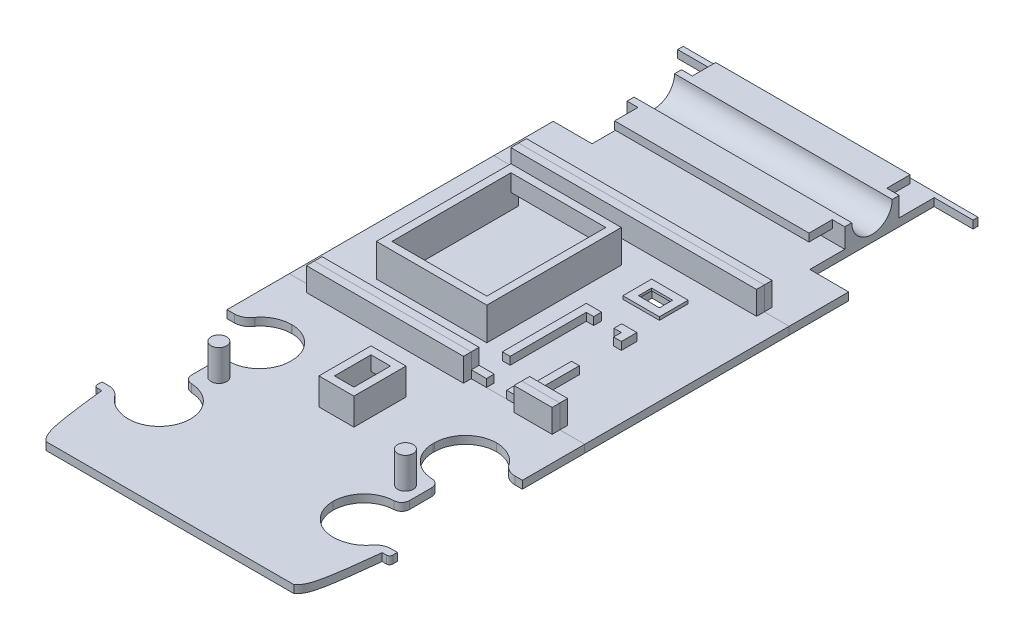
from build123d import *

# Parameters (mm, degrees)
CROQUIS1_W               = 140
CROQUIS1_H               = 490
SALIENTE_EXTRUIR1_DEPTH  = 5
CROQUIS2_R               = 5
SALIENTE_EXTRUIR2_DEPTH  = 20
SALIENTE_EXTRUIR3_DEPTH  = 140
CROQUIS4_W               = 55
CROQUIS4_H               = 5
CROQUIS4_W_2             = 205
CROQUIS4_W_3             = 60
SALIENTE_EXTRUIR4_DEPTH  = 25
CROQUIS5_W               = 60
CROQUIS5_H               = 5
CROQUIS5_W_2             = 205
CROQUIS5_W_3             = 55
SALIENTE_EXTRUIR5_DEPTH  = 25
CROQUIS6_W               = 35.863761151
CROQUIS6_H               = 39.757540934
CROQUIS6_H_2             = 40.782219824
CORTAR_EXTRUIR1_DEPTH    = 264.533679062
REDONDEO1_R              = 5
CORTAR_EXTRUIR2_REACH    = 265.534
CORTAR_EXTRUIR3_REACH    = 265.534
CROQUIS9_W               = 22.5
CROQUIS9_H               = 33.5
CROQUIS9_W_2             = 12.5
CROQUIS9_H_2             = 23.5
SALIENTE_EXTRUIR6_DEPTH  = 17.3
CORTAR_EXTRUIR4_REACH    = 302.975
CROQUIS11_W              = 12.5
CROQUIS11_H              = 8
CROQUIS12_W              = 81
CROQUIS12_H              = 96.5
CROQUIS12_W_2            = 61
CROQUIS12_H_2            = 76.5
SALIENTE_EXTRUIR7_DEPTH  = 21
CORTAR_EXTRUIR5_REACH    = 269.763
CROQUIS13_W              = 61
CROQUIS13_H              = 10
REDONDEO2_R              = 20
REDONDEO3_R              = 20
REDONDEO4_R              = 20
CROQUIS14_W              = 13.297924196
CROQUIS14_H              = 5
SALIENTE_EXTRUIR8_DEPTH  = 4.816753
REDONDEO5_R              = 10
CROQUIS15_W              = 13.297924196
CROQUIS15_H              = 5
SALIENTE_EXTRUIR9_DEPTH  = 4.816753
REDONDEO6_R              = 10
SALIENTE_EXTRUIR10_DEPTH = 5
CROQUIS17_R              = 13
CORTAR_EXTRUIR6_DEPTH    = 290.478958921
CROQUIS18_W              = 125
CROQUIS18_H              = 5
SALIENTE_EXTRUIR11_DEPTH = 15
CROQUIS19_W              = 125
CROQUIS19_H              = 5
SALIENTE_EXTRUIR12_DEPTH = 15
SALIENTE_EXTRUIR13_DEPTH = 5
CORTAR_EXTRUIR7_START    = -21
CROQUIS21_W              = 81
CROQUIS21_H              = 96.5
CROQUIS21_W_2            = 71
CROQUIS21_H_2            = 86.5
CORTAR_EXTRUIR7_DEPTH    = 21
CROQUIS22_W              = 23.5
CROQUIS22_H              = 18.5
CROQUIS22_W_2            = 13.5
CROQUIS22_H_2            = 8.5
SALIENTE_EXTRUIR14_DEPTH = 2
CROQUIS23_W              = 13.5
CROQUIS23_H              = 8.5
CORTAR_EXTRUIR8_DEPTH    = 256.662018384
CROQUIS24_W              = 16
CROQUIS24_H              = 11.5
CORTAR_EXTRUIR9_DEPTH    = 5.5
CROQUIS25_W              = 158
CROQUIS25_H              = 10
CROQUIS25_W_2            = 101.022508216
CROQUIS25_W_3            = 24.477491784
SALIENTE_EXTRUIR15_DEPTH = 15


# Read off the part's stored shape, not the designer's step: Partir2
with BuildPart() as part:
    # Croquis1 → Saliente-Extruir1 (new body)
    with BuildSketch(Plane(origin=(0, 0, 0), x_dir=(1, 0, 0), z_dir=(0, 1, 0))):
        Rectangle(CROQUIS1_W, CROQUIS1_H)
    extrude(amount=SALIENTE_EXTRUIR1_DEPTH)

    # Croquis2 → Saliente-Extruir2 (add)
    with BuildSketch(Plane(origin=(0, 5, 0), x_dir=(1, 0, 0), z_dir=(0, 1, 0))):
        with Locations(Location((60, -145, 0), (0, 0, 270))):
            Circle(CROQUIS2_R)
        with Locations(Location((-60, -145, 0), (0, 0, 90))):
            Circle(CROQUIS2_R)
    extrude(amount=SALIENTE_EXTRUIR2_DEPTH)

    # Croquis3 → Saliente-Extruir3 (add, through all)
    with BuildSketch(Plane(origin=(70, 0, 0), x_dir=(0, 0, -1), z_dir=(1, 0, 0))):
        with BuildLine():
            Line((158, 17.5), (162.5, 17.5))
            Line((162.5, 17.5), (162.5, 5.107393915))
            Line((162.5, 5.107393915), (159.549400497, 3.568901756))
            Line((159.549400497, 3.568901756), (127.5, 4.093822174))
            Line((127.5, 4.093822174), (127.5, 6.056909612))
            Line((127.5, 6.056909612), (127.5, 17.5))
            Line((127.5, 17.5), (132, 17.5))
            ThreePointArc((132, 17.5), (145, 4.5), (158, 17.5))
        make_face()
    extrude(amount=-SALIENTE_EXTRUIR3_DEPTH)

    # Croquis4 → Saliente-Extruir4 (add)
    with BuildSketch(Plane(origin=(70, 0, 0), x_dir=(0, 0, -1), z_dir=(1, 0, 0))):
        with Locations((-217.5, 2.5)):
            Rectangle(CROQUIS4_W, CROQUIS4_H)
        with Locations((2.5, 2.5)):
            Rectangle(CROQUIS4_W_2, CROQUIS4_H)
        with Locations((215, 2.5)):
            Rectangle(CROQUIS4_W_3, CROQUIS4_H)
    extrude(amount=SALIENTE_EXTRUIR4_DEPTH)

    # Croquis5 → Saliente-Extruir5 (add)
    with BuildSketch(Plane.ZY.offset(70)):
        with Locations((-215, 2.5)):
            Rectangle(CROQUIS5_W, CROQUIS5_H)
        with Locations((-2.5, 2.5)):
            Rectangle(CROQUIS5_W_2, CROQUIS5_H)
        with Locations((217.5, 2.5)):
            Rectangle(CROQUIS5_W_3, CROQUIS5_H)
    extrude(amount=SALIENTE_EXTRUIR5_DEPTH)

    # Croquis6 → Cortar-Extruir1 (cut, through all)
    with BuildSketch(Plane(origin=(0, 5, 0), x_dir=(1, 0, 0), z_dir=(0, 1, 0))):
        with Locations((63.770195229, -177.328194943)):
            Rectangle(CROQUIS6_W, CROQUIS6_H)
        with Locations((-63.770195229, -177.328194943)):
            Rectangle(CROQUIS6_W, CROQUIS6_H)
        with Locations((-63.770195229, -112.670956981)):
            Rectangle(CROQUIS6_W, CROQUIS6_H_2)
        with Locations((63.770195229, -112.670956981)):
            Rectangle(CROQUIS6_W, CROQUIS6_H_2)
    extrude(amount=-CORTAR_EXTRUIR1_DEPTH, mode=Mode.SUBTRACT)

    # Redondeo1
    redondeo1_edges = [part.edges().sort_by_distance(p)[0] for p in [
        (70, 2.5, 157.449424476),
        (-70, 2.5, 133.062066893),
        (-70, 2.5, 157.449424476),
        (70, 2.5, 133.062066893),
    ]]
    fillet(redondeo1_edges, radius=REDONDEO1_R)

    # Croquis7 → Cortar-Extruir2 (cut, up to next)
    with BuildSketch(Plane(origin=(0, 5, 0), x_dir=(1, 0, 0), z_dir=(0, 1, 0)), mode=Mode.PRIVATE) as cortar_extruir2_sk1:
        Polygon((-95, 188.571267431), (95, 188.183246837), (95, 245), (-95, 245), align=None)
    cortar_extruir2_tool1 = extrude(cortar_extruir2_sk1.sketch, amount=-CORTAR_EXTRUIR2_REACH, mode=Mode.PRIVATE) & part.part
    add(cortar_extruir2_tool1.solids().sort_by_distance((0.108502, 5, -216.688518))[0], mode=Mode.SUBTRACT)

    # Croquis8 → Cortar-Extruir3 (cut, up to next)
    with BuildSketch(Plane(origin=(0, 5, 0), x_dir=(1, 0, 0), z_dir=(0, 1, 0)), mode=Mode.PRIVATE) as cortar_extruir3_sk1:
        Polygon((-95, -190), (-45.838314653, -190), (-45.838314653, -197.20696541), (45.838314653, -197.20696541), (45.838314653, -190), (95, -190), (95, -245), (-95, -245), align=None)
    cortar_extruir3_tool1 = extrude(cortar_extruir3_sk1.sketch, amount=-CORTAR_EXTRUIR3_REACH, mode=Mode.PRIVATE) & part.part
    add(cortar_extruir3_tool1.solids().sort_by_distance((0, 5, 219.112852))[0], mode=Mode.SUBTRACT)

    # Croquis9 → Saliente-Extruir6 (add)
    with BuildSketch(Plane(origin=(0, 5, 0), x_dir=(1, 0, 0), z_dir=(0, 1, 0))):
        with Locations((0, -112.670956981)):
            Rectangle(CROQUIS9_W, CROQUIS9_H)
        with Locations((0, -112.670956981)):
            Rectangle(CROQUIS9_W_2, CROQUIS9_H_2, mode=Mode.SUBTRACT)
    extrude(amount=SALIENTE_EXTRUIR6_DEPTH)

    # Croquis11 → Cortar-Extruir4 (cut, up to next)
    with BuildSketch(Plane(origin=(0, 0, 95.920956981), x_dir=(-1, 0, 0), z_dir=(0, 0, -1)), mode=Mode.PRIVATE) as cortar_extruir4_sk1:
        with Locations((0, 9)):
            Rectangle(CROQUIS11_W, CROQUIS11_H)
    cortar_extruir4_tool1 = extrude(cortar_extruir4_sk1.sketch, amount=-CORTAR_EXTRUIR4_REACH, mode=Mode.PRIVATE) & part.part
    add(cortar_extruir4_tool1.solids().sort_by_distance((0, 9, 95.920957))[0], mode=Mode.SUBTRACT)

    # Croquis12 → Saliente-Extruir7 (add)
    with BuildSketch(Plane(origin=(0, 5, 0), x_dir=(1, 0, 0), z_dir=(0, 1, 0))):
        with Locations((-28.477491784, 3.533159356)):
            Rectangle(CROQUIS12_W, CROQUIS12_H)
        with Locations((-28.477491784, 3.533159356)):
            Rectangle(CROQUIS12_W_2, CROQUIS12_H_2, mode=Mode.SUBTRACT)
    extrude(amount=SALIENTE_EXTRUIR7_DEPTH)

    # Croquis13 → Cortar-Extruir5 (cut, up to next)
    with BuildSketch(Plane(origin=(0, 0, -51.783159356), x_dir=(-1, 0, 0), z_dir=(0, 0, -1)), mode=Mode.PRIVATE) as cortar_extruir5_sk1:
        with Locations((28.477491784, 10)):
            Rectangle(CROQUIS13_W, CROQUIS13_H)
    cortar_extruir5_tool1 = extrude(cortar_extruir5_sk1.sketch, amount=-CORTAR_EXTRUIR5_REACH, mode=Mode.PRIVATE) & part.part
    add(cortar_extruir5_tool1.solids().sort_by_distance((-28.477492, 10, -51.783159))[0], mode=Mode.SUBTRACT)

    # Redondeo2
    # the kernel refuses this fillet: 20 mm, written as the material it adds along each edge
    with BuildSketch(Plane(origin=(81.702075804, 5, 92.279847069), x_dir=(-1, 0, 0), z_dir=(0, -1, 0))) as redondeo2_piece_1:
        with BuildLine():
            CenterArc((15.786239449, -20), REDONDEO2_R, 90, 52.121260667)
            Line((0, -7.720152931), (-0.315724789, -7.474555989))
            ThreePointArc((-0.315724789, -7.474555989), (-0.4, -3.860076465), (-0.4, 0))
            Line((-0.4, 0), (0, 0.4))
            Line((0, 0.4), (15.786239449, 0.4))
            Line((15.786239449, 0.4), (15.786239449, 0))
        make_face()
    extrude(amount=5)

    # Redondeo3
    redondeo3_edges = [part.edges().sort_by_distance(p)[0] for p in [
        (45.838314653, 2.5, 157.449424476),
        (45.838314653, 2.5, 92.279847069),
        (45.838314653, 2.5, 133.062066893),
    ]]
    fillet(redondeo3_edges, radius=REDONDEO3_R)

    # Redondeo4
    # the kernel refuses this fillet: 20 mm, written as the material it adds along each edge
    with BuildSketch(Plane(origin=(-45.838314653, 5, 157.449424476), x_dir=(0, 0, 1), z_dir=(0, -1, 0))) as redondeo4_piece_1:
        with BuildLine():
            CenterArc((19.985940618, 20), REDONDEO4_R, 181.921635901, 88.078364099)
            Line((-0.002811876, 19.329348278), (-2.001687126, 19.262283105))
            ThreePointArc((-2.001687126, 19.262283105), (-2, 19.161685347), (-2, 0))
            Line((-2, 0), (0, -2))
            Line((0, -2), (19.985940618, -2))
            Line((19.985940618, -2), (19.985940618, 0))
        make_face()
    extrude(amount=5)
    with BuildSketch(Plane(origin=(-45.838314653, 5, 133.062066893), x_dir=(-0.9999999894189673, 0, 0.0001454718712798051), z_dir=(0, -1, 0))) as redondeo4_piece_2:
        with BuildLine():
            CenterArc((19.997092396, 19.988849843), REDONDEO4_R, 180.008334924, 88.078364099)
            Line((-0.002907392, 19.985940406), (-2.002907371, 19.985649462))
            Line((-2.002907371, 19.985649462), (-1.999999979, -0.000290944))
            Line((-1.999999979, -0.000290944), (0.000290944, -1.999999979))
            ThreePointArc((0.000290944, -1.999999979), (19.161976088, -1.997212493), (19.262574091, -1.998884984))
            Line((19.262574091, -1.998884984), (19.329348482, 0))
        make_face()
    extrude(amount=5)
    with BuildSketch(Plane(origin=(-81.702075804, 5, 92.279847069), x_dir=(1, 0, 0), z_dir=(0, -1, 0))) as redondeo4_piece_3:
        with BuildLine():
            CenterArc((15.786239449, 20), REDONDEO4_R, 217.878739333, 52.121260667)
            Line((0, 7.720152931), (-0.315724789, 7.474555989))
            ThreePointArc((-0.315724789, 7.474555989), (-0.4, 3.860076465), (-0.4, 0))
            Line((-0.4, 0), (0, -0.4))
            Line((0, -0.4), (15.786239449, -0.4))
            Line((15.786239449, -0.4), (15.786239449, 0))
        make_face()
    extrude(amount=5)
    with BuildSketch(Plane(origin=(-45.838314653, 5, 92.279847069), x_dir=(0, 0, 1), z_dir=(0, -1, 0))) as redondeo4_piece_4:
        with BuildLine():
            CenterArc((REDONDEO4_R, REDONDEO4_R), REDONDEO4_R, 180, 90)
            Line((0, REDONDEO4_R), (-REDONDEO4_R * 0.02, REDONDEO4_R))
            Line((-REDONDEO4_R * 0.02, REDONDEO4_R), (-REDONDEO4_R * 0.02, -REDONDEO4_R * 0.02))
            Line((-REDONDEO4_R * 0.02, -REDONDEO4_R * 0.02), (REDONDEO4_R, -REDONDEO4_R * 0.02))
            Line((REDONDEO4_R, -REDONDEO4_R * 0.02), (REDONDEO4_R, 0))
        make_face()
    extrude(amount=5)

    # Croquis14 → Saliente-Extruir8 (add)
    with BuildSketch(Plane.XY.offset(100)):
        with Locations((-88.351037902, 2.5)):
            Rectangle(CROQUIS14_W, CROQUIS14_H)
    extrude(amount=SALIENTE_EXTRUIR8_DEPTH)

    # Redondeo5
    # the kernel refuses this fillet: 10 mm, written as the material it takes off along each edge
    with BuildSketch(Plane(origin=(-81.702075804, -21.379597537, 104.816753), x_dir=(0, 0, -1), z_dir=(0, 1, 0))) as redondeo5_piece_1:
        with BuildLine():
            CenterArc((10, 8.551839015), REDONDEO5_R, 180, 58.780057368)
            Line((0, 8.551839015), (-0.2, 8.551839015))
            Line((-0.2, 8.551839015), (-0.2, 0))
            Line((-0.2, 0), (0, -0.2))
            ThreePointArc((0, -0.2), (2.4083765, -0.2), (4.71308806, -0.17103678))
            Line((4.71308806, -0.17103678), (4.816753, 0))
        make_face()
    extrude(amount=47.759195075, mode=Mode.SUBTRACT)

    # Croquis15 → Saliente-Extruir9 (add)
    with BuildSketch(Plane.XY.offset(100)):
        with Locations((88.351037902, 2.5)):
            Rectangle(CROQUIS15_W, CROQUIS15_H)
    extrude(amount=SALIENTE_EXTRUIR9_DEPTH)

    # Redondeo6
    # the kernel refuses this fillet: 10 mm, written as the material it takes off along each edge
    with BuildSketch(Plane(origin=(81.702075804, 26.379597537, 104.816753), x_dir=(1, 0, 0), z_dir=(0, -1, 0))) as redondeo6_piece_1:
        with BuildLine():
            CenterArc((8.551839015, -10), REDONDEO6_R, 90, 58.780057368)
            Line((0, -4.816753), (-0.17103678, -4.71308806))
            ThreePointArc((-0.17103678, -4.71308806), (-0.2, -2.4083765), (-0.2, 0))
            Line((-0.2, 0), (0, 0.2))
            Line((0, 0.2), (8.551839015, 0.2))
            Line((8.551839015, 0.2), (8.551839015, 0))
        make_face()
    extrude(amount=47.759195075, mode=Mode.SUBTRACT)

    # Croquis16 → Saliente-Extruir10 (add)
    with BuildSketch(Plane(origin=(0, 5, 0), x_dir=(1, 0, 0), z_dir=(0, 1, 0))):
        with BuildLine():
            Line((0, -197.20696541), (0, -236.425606855))
            Line((0, -236.425606855), (79.708079327, -236.425606855))
            add(Edge.make_bspline(
                [(90.190596692, -190.183246837), (89.128085581, -200.331209429), (87.537107611, -213.025752597), (86.234126264, -222.772198421), (85.045671452, -229.279833842), (83.142021691, -233.523740473), (79.708079329, -236.425606857)],
                knots=[0.105381553, 0.105381553, 0.105381553, 0.105381553, 0.105381553, 0.105381553, 0.105381553, 0.591020097, 0.591020097, 0.591020097, 0.591020097, 0.591020097, 0.591020097, 0.591020097], degree=6))
            Line((90.190596692, -190.183246837), (93, -190.183246837))
            ThreePointArc((93, -190.183246837), (94.414213562, -189.597460399), (95, -188.183246837))
            Line((95, -188.183246837), (95, -185.183246837))
            Line((95, -185.183246837), (90.823110649, -185.183246837))
            ThreePointArc((90.823110649, -185.183246837), (86.354945054, -186.236990848), (82.828440006, -189.176147594))
            ThreePointArc((82.828440006, -189.176147594), (77.917397118, -193.813414648), (71.742802621, -196.551474323))
            Line((71.742802621, -196.551474323), (70.74200824, -196.804580021))
            ThreePointArc((70.74200824, -196.804580021), (53.559620255, -193.202198852), (45.838314653, -177.435365094))
            Line((45.838314653, -177.435365094), (45.838314653, -197.20696541))
            Line((45.838314653, -197.20696541), (0, -197.20696541))
        make_face()
        with BuildLine():
            add(Edge.make_bspline(
                [(-79.708079329, -236.425606857), (-83.142021691, -233.523740473), (-85.045671452, -229.279833842), (-86.234126264, -222.772198421), (-87.537107611, -213.025752597), (-89.128085581, -200.331209429), (-90.190596692, -190.183246837)],
                knots=[0.408979903, 0.408979903, 0.408979903, 0.408979903, 0.408979903, 0.408979903, 0.408979903, 0.894618447, 0.894618447, 0.894618447, 0.894618447, 0.894618447, 0.894618447, 0.894618447], degree=6))
            Line((-79.708079327, -236.425606855), (0, -236.425606855))
            Line((0, -236.425606855), (0, -197.20696541))
            Line((0, -197.20696541), (-45.838314653, -197.20696541))
            Line((-45.838314653, -197.20696541), (-45.838314653, -177.435365094))
            ThreePointArc((-45.838314653, -177.435365094), (-53.559620255, -193.202198852), (-70.74200824, -196.804580021))
            Line((-70.74200824, -196.804580021), (-71.742802621, -196.551474323))
            ThreePointArc((-71.742802621, -196.551474323), (-77.917397118, -193.813414648), (-82.828440006, -189.176147594))
            ThreePointArc((-82.828440006, -189.176147594), (-86.354945054, -186.236990848), (-90.823110649, -185.183246837))
            Line((-90.823110649, -185.183246837), (-95, -185.183246837))
            Line((-95, -185.183246837), (-95, -188.183246837))
            ThreePointArc((-95, -188.183246837), (-94.414213562, -189.597460399), (-93, -190.183246837))
            Line((-93, -190.183246837), (-90.190596692, -190.183246837))
        make_face()
    extrude(amount=-SALIENTE_EXTRUIR10_DEPTH)

    # Croquis17 → Cortar-Extruir6 (cut, through all)
    with BuildSketch(Plane(origin=(70, 0, 0), x_dir=(0, 0, -1), z_dir=(1, 0, 0))):
        with Locations((145, 17.5)):
            Circle(CROQUIS17_R)
    extrude(amount=-CORTAR_EXTRUIR6_DEPTH, mode=Mode.SUBTRACT)

    # Croquis18 → Saliente-Extruir11 (add)
    with BuildSketch(Plane.XY.offset(-127.5)):
        with Locations((-0.5, 15)):
            Rectangle(CROQUIS18_W, CROQUIS18_H)
    extrude(amount=SALIENTE_EXTRUIR11_DEPTH)

    # Croquis19 → Saliente-Extruir12 (add)
    with BuildSketch(Plane(origin=(0, 0, -162.5), x_dir=(-1, 0, 0), z_dir=(0, 0, -1))):
        with Locations((0.5, 15)):
            Rectangle(CROQUIS19_W, CROQUIS19_H)
    extrude(amount=SALIENTE_EXTRUIR12_DEPTH)

    # Croquis20 → Saliente-Extruir13 (add)
    with BuildSketch(Plane(origin=(0, 5, 0), x_dir=(1, 0, 0), z_dir=(0, 1, 0))):
        Polygon((22.022508216, -44.716840644), (22.022508216, 9.283159356), (31.772508216, 9.283159356), (31.772508216, 4.283159356), (27.022508216, 4.283159356), (27.022508216, -44.716840644), align=None)
        Polygon((44.772508216, 9.283159356), (44.772508216, 4.283159356), (49.522508216, 4.283159356), (49.522508216, -0.716840644), (54.522508216, -0.716840644), (54.522508216, 9.283159356), align=None)
        Polygon((44.772508216, -59.716840644), (49.522508216, -59.716840644), (49.522508216, -27.716840644), (54.522508216, -27.716840644), (54.522508216, -64.716840644), (44.772508216, -64.716840644), align=None)
        Polygon((31.772508216, -64.716840644), (22.022508216, -64.716840644), (22.022508216, -59.716840644), (27.022508216, -59.716840644), (31.772508216, -59.716840644), align=None)
    extrude(amount=SALIENTE_EXTRUIR13_DEPTH)

    # Croquis21 → Cortar-Extruir7 (cut)
    with BuildSketch(Plane(origin=(0, 26, 0), x_dir=(1, 0, 0), z_dir=(0, 1, 0)).offset(CORTAR_EXTRUIR7_START)):
        with Locations((-28.477491784, 3.533159356)):
            Rectangle(CROQUIS21_W, CROQUIS21_H)
        with Locations((-28.477491784, 3.533159356)):
            Rectangle(CROQUIS21_W_2, CROQUIS21_H_2, mode=Mode.SUBTRACT)
    extrude(amount=CORTAR_EXTRUIR7_DEPTH, mode=Mode.SUBTRACT)

    # Croquis22 → Saliente-Extruir14 (add)
    with BuildSketch(Plane(origin=(0, 5, 0), x_dir=(1, 0, 0), z_dir=(0, 1, 0))):
        with Locations((38.272508216, 37.533159356)):
            Rectangle(CROQUIS22_W, CROQUIS22_H)
        with Locations((38.272508216, 37.533159356)):
            Rectangle(CROQUIS22_W_2, CROQUIS22_H_2, mode=Mode.SUBTRACT)
    extrude(amount=SALIENTE_EXTRUIR14_DEPTH)

    # Croquis23 → Cortar-Extruir8 (cut, through all)
    with BuildSketch(Plane(origin=(0, 5, 0), x_dir=(1, 0, 0), z_dir=(0, 1, 0))):
        with Locations((38.272508216, 37.533159356)):
            Rectangle(CROQUIS23_W, CROQUIS23_H)
    extrude(amount=-CORTAR_EXTRUIR8_DEPTH, mode=Mode.SUBTRACT)

    # Croquis24 → Cortar-Extruir9 (cut)
    with BuildSketch(Plane.XZ):
        with Locations((38.272508216, -37.533159356)):
            Rectangle(CROQUIS24_W, CROQUIS24_H)
    extrude(amount=-CORTAR_EXTRUIR9_DEPTH, mode=Mode.SUBTRACT)

    # Croquis25 → Saliente-Extruir15 (add)
    with BuildSketch(Plane(origin=(0, 5, 0), x_dir=(1, 0, 0), z_dir=(0, 1, 0))):
        with Locations((0, 66.762581921)):
            Rectangle(CROQUIS25_W, CROQUIS25_H)
        with Locations((-28.488745892, -64.716840644)):
            Rectangle(CROQUIS25_W_2, CROQUIS25_H)
        with Locations((66.761254108, -64.716840644)):
            Rectangle(CROQUIS25_W_3, CROQUIS25_H)
    extrude(amount=SALIENTE_EXTRUIR15_DEPTH)


with BuildPart() as body_2:
    # Partir1: the piece on the far side of the plane
    add(part.part)
    split(bisect_by=Plane.XY.offset(64.716840644), keep=Keep.BOTTOM)


with BuildPart() as part_1:
    add(part.part)

    # Partir1
    split(bisect_by=Plane.XY.offset(64.716840644), keep=Keep.TOP)


with BuildPart() as body_3:
    # Partir2: the piece on the far side of the plane
    add(body_2.part)
    split(bisect_by=Plane.XY.offset(-66.762581921), keep=Keep.BOTTOM)


with BuildPart() as body_2_1:
    add(body_2.part)

    # Partir2
    split(bisect_by=Plane.XY.offset(-66.762581921), keep=Keep.TOP)


solid = Compound([part_1.part, body_3.part, body_2_1.part])
